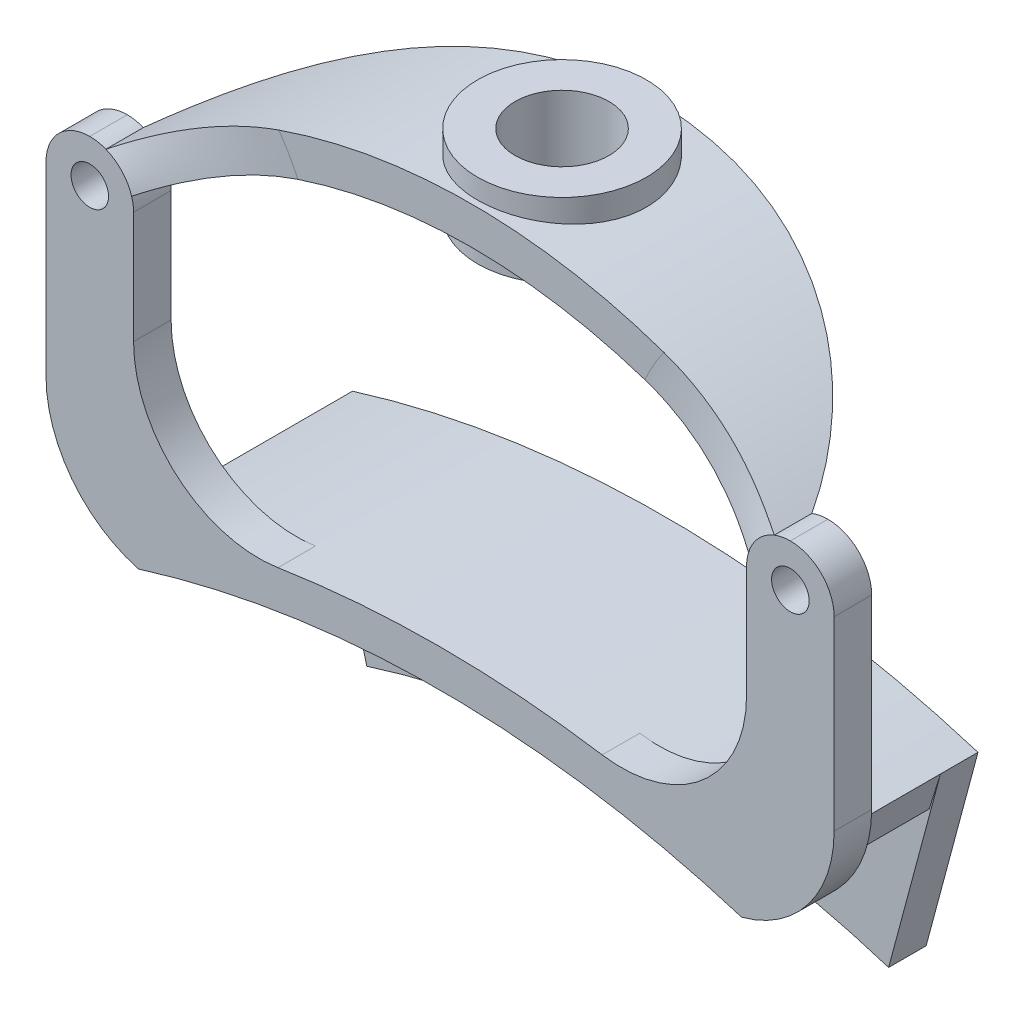
from build123d import *

# Parameters (mm, degrees)
SKETCH1_R                 = 2
BOSS_EXTRUDE1_DEPTH       = 3
BOSS_EXTRUDE2_DEPTH       = 12
SKETCH3_R                 = 1.5
BOSS_EXTRUDE3_DEPTH       = 3
FILLET1_R                 = 10
FILLET3_R                 = 3.5
BOSS_EXTRUDE6_DEPTH       = 14
BOSS_EXTRUDE7_DEPTH       = 0.5
BOSS_EXTRUDE8_START       = -14
BOSS_EXTRUDE8_DEPTH       = 14
FILLET7_R                 = 30
FILLET11_R                = 30
CUT_EXTRUDE3_REACH        = 52.603
CUT_EXTRUDE3_END_RADIUS   = 47
SKETCH12_R                = 3.75
BOSS_EXTRUDE9_REACH       = 64
BOSS_EXTRUDE9_END_RADIUS  = 47
SKETCH13_R                = 6.75
SKETCH13_R_2              = 3.75
BOSS_EXTRUDE10_REACH      = 59.242
BOSS_EXTRUDE10_END_RADIUS = 44
SKETCH14_R                = 6.75
SKETCH14_R_2              = 3.75


# Some blends are built 0.0001 mm under size
with BuildPart() as part:
    # Sketch1 → Boss-Extrude1 (new body)
    with BuildSketch(Plane.XY):
        with BuildLine():
            Line((20.854716842, 64.723108589), (25, 80.193515947))
            ThreePointArc((25, 80.193515947), (0, 84), (-25, 80.193515947))
            Line((-25, 80.193515947), (-20.854716842, 64.723108589))
            ThreePointArc((-20.854716842, 64.723108589), (0, 68), (20.854716842, 64.723108589))
        make_face()
        with Locations((15, 70.420167566)):
            Circle(SKETCH1_R, mode=Mode.SUBTRACT)
        with Locations(Location((-15, 70.420167566, 0), (0, 0, 180))):
            Circle(SKETCH1_R, mode=Mode.SUBTRACT)
    extrude(amount=BOSS_EXTRUDE1_DEPTH)

    # Sketch2 → Boss-Extrude2 (add)
    with BuildSketch(Plane.XY.offset(3)):
        with BuildLine():
            Line((-25, 80.193515947), (-24.107142857, 77.329461806))
            ThreePointArc((-24.107142857, 77.329461806), (0, 81), (24.107142857, 77.329461806))
            Line((24.107142857, 77.329461806), (25, 80.193515947))
            ThreePointArc((25, 80.193515947), (0, 84), (-25, 80.193515947))
        make_face()
    extrude(amount=BOSS_EXTRUDE2_DEPTH)

    # Sketch3 → Boss-Extrude3 (add)
    with BuildSketch(Plane.XY.offset(15)):
        with BuildLine():
            Line((-31.5, 77.329461806), (-31.5, 105.329461806))
            Line((-31.5, 105.329461806), (-24.5, 105.329461806))
            Line((-24.5, 105.329461806), (-24.5, 80.347681983))
            ThreePointArc((-24.5, 80.347681983), (0, 84), (24.5, 80.347681983))
            Line((24.5, 80.347681983), (24.5, 105.329461806))
            Line((24.5, 105.329461806), (31.5, 105.329461806))
            Line((31.5, 105.329461806), (31.5, 77.329461806))
            Line((31.5, 77.329461806), (24.107142857, 77.329461806))
            ThreePointArc((24.107142857, 77.329461806), (0, 81), (-24.107142857, 77.329461806))
            Line((-24.107142857, 77.329461806), (-31.5, 77.329461806))
        make_face()
        with Locations((-28, 101.920167566)):
            Circle(SKETCH3_R, mode=Mode.SUBTRACT)
        with Locations(Location((28, 101.920167566, 0), (0, 0, 180))):
            Circle(SKETCH3_R, mode=Mode.SUBTRACT)
    extrude(amount=BOSS_EXTRUDE3_DEPTH)

    # Fillet1
    # the kernel refuses this fillet: 10 mm, written as the material it adds along each edge
    with BuildSketch(Plane(origin=(24.5, 80.347681983, 15), x_dir=(-0.9747000358663407, 0.22351697940459464, 0), z_dir=(0, 0, 1))) as fillet1_piece_1:
        with BuildLine():
            CenterArc((12.54704984, -9.975125536), FILLET1_R, 94.042076765, 98.87360977)
            Line((2.800049481, -12.21029533), (0, 0))
            ThreePointArc((0, 0), (5.9210797, -0.208945494), (11.8421594, 0))
        make_face()
    extrude(amount=3)
    with BuildSketch(Plane(origin=(-24.5, 80.347681983, 15), x_dir=(0.9747000358663402, 0.22351697940459697, 0), z_dir=(0, 0, 1))) as fillet1_piece_2:
        with BuildLine():
            CenterArc((12.54704984, 9.975125536), FILLET1_R, 167.084313465, 98.87360977)
            Line((2.800049481, 12.21029533), (0, 0))
            ThreePointArc((0, 0), (5.9210797, 0.208945494), (11.8421594, 0))
        make_face()
    extrude(amount=3)
    # the kernel refuses this fillet: 10 mm, written as the material it takes off along each edge
    with BuildSketch(Plane(origin=(31.5, 77.329461806, 15), x_dir=(0, 1, 0), z_dir=(0, 0, 1))) as fillet1_2_piece_1:
        with BuildLine():
            CenterArc((9.654160042, 10), FILLET1_R, 195.112449543, 74.887550457)
            Line((0, 7.392857143), (0, 0))
            Line((0, 0), (9.654160042, 0))
        make_face()
    extrude(amount=27.135400106, mode=Mode.SUBTRACT)
    with BuildSketch(Plane(origin=(-31.5, 77.329461806, 15), x_dir=(0, 1, 0), z_dir=(0, 0, 1))) as fillet1_2_piece_2:
        with BuildLine():
            CenterArc((9.654160042, -10), FILLET1_R, 90, 74.887550457)
            Line((0, -7.392857143), (0, 0))
            Line((0, 0), (9.654160042, 0))
        make_face()
    extrude(amount=27.135400106, mode=Mode.SUBTRACT)

    # Fillet3
    fillet3_edges = [part.edges().sort_by_distance(p)[0] for p in [
        (31.5, 105.329461806, 16.5),
        (24.5, 105.329461806, 16.5),
        (-24.5, 105.329461806, 16.5),
        (-31.5, 105.329461806, 16.5),
    ]]
    fillet(fillet3_edges, radius=FILLET3_R - 0.0001)  # a hair under: the kernel refuses the full size



with BuildPart() as body_2:
    # Sketch9 → Boss-Extrude6 (new body)
    with BuildSketch(Plane(origin=(0, 0, 15), x_dir=(-1, 0, 0), z_dir=(0, 0, -1))):
        with BuildLine():
            ThreePointArc((24.654911386, 102.8592104), (0, 110.415619131), (-24.654911386, 102.8592104))
            ThreePointArc((-24.654911386, 102.8592104), (-25.431275444, 104.2067826), (-26.71481938, 105.084966494))
            ThreePointArc((-26.71481938, 105.084966494), (0, 113.415619131), (26.71481938, 105.084966494))
            ThreePointArc((26.71481938, 105.084966494), (25.431275444, 104.2067826), (24.654911386, 102.8592104))
        make_face()
    extrude(amount=BOSS_EXTRUDE6_DEPTH)


with BuildPart() as part_1:
    add(part.part)

    add(body_2.part)  # Boss-Extrude7 merges body 2
    # Sketch10 → Boss-Extrude7 (add)
    with BuildSketch(Plane.XY.offset(15)):
        with BuildLine():
            ThreePointArc((-24.654911386, 102.8592104), (-25.431275444, 104.2067826), (-26.71481938, 105.084966494))
            ThreePointArc((-26.71481938, 105.084966494), (0, 113.415619131), (26.71481938, 105.084966494))
            ThreePointArc((26.71481938, 105.084966494), (25.431275444, 104.2067826), (24.654911386, 102.8592104))
            ThreePointArc((24.654911386, 102.8592104), (0, 110.415619131), (-24.654911386, 102.8592104))
        make_face()
    extrude(amount=BOSS_EXTRUDE7_DEPTH)

    # Sketch11 → Boss-Extrude8 (add)
    with BuildSketch(Plane(origin=(0, 0, 1), x_dir=(-1, 0, 0), z_dir=(0, 0, -1)).offset(BOSS_EXTRUDE8_START)):
        with BuildLine():
            Line((-26.71481938, 105.084966494), (-24.654911386, 102.8592104))
            ThreePointArc((-24.654911386, 102.8592104), (-25.431275444, 104.2067826), (-26.71481938, 105.084966494))
        make_face()
        with BuildLine():
            Line((26.71481938, 105.084966494), (24.654911386, 102.8592104))
            ThreePointArc((24.654911386, 102.8592104), (25.431275444, 104.2067826), (26.71481938, 105.084966494))
        make_face()
    extrude(amount=BOSS_EXTRUDE8_DEPTH)

    # Fillet7
    # the kernel refuses this fillet: 30 mm, written as the material it takes off along each edge
    with BuildSketch(Plane(origin=(69.80741828, 151.647053217, 1), x_dir=(-0.7339213016528682, 0.6792345125066597, 0), z_dir=(-0.6792345125066598, -0.7339213016528682, 0))) as fillet7_piece_1_section:
        with BuildLine():
            CenterArc((25.377155081, -30), FILLET7_R, 90, 57.769047365)
            Line((0, -14), (0, 0))
            Line((0, 0), (25.377155081, 0))
        make_face()
    fillet7_piece_1 = extrude(amount=129.918465817, mode=Mode.PRIVATE)
    fillet7_piece_1 = fillet7_piece_1 - Plane(origin=(0, 0, 1), x_dir=(0.2976190476190481, 0.9546847136590859, 0), z_dir=(0, 0, -1)) * Cylinder(84, 362, mode=Mode.PRIVATE)
    add(fillet7_piece_1, mode=Mode.SUBTRACT)
    with BuildSketch(Plane(origin=(-69.80741828, 151.647053217, 1), x_dir=(0, 0, 1), z_dir=(0.6792345125066636, -0.7339213016528646, 0))) as fillet7_piece_2_section:
        with BuildLine():
            CenterArc((30, -25.377155081), FILLET7_R, 122.230952636, 57.769047365)
            Line((0, -25.377155081), (0, 0))
            Line((0, 0), (14, 0))
        make_face()
    fillet7_piece_2 = extrude(amount=129.918465817, mode=Mode.PRIVATE)
    fillet7_piece_2 = fillet7_piece_2 - Plane(origin=(0, 0, 1), x_dir=(0.2976190476190481, 0.9546847136590859, 0), z_dir=(0, 0, -1)) * Cylinder(84, 362, mode=Mode.PRIVATE)
    add(fillet7_piece_2, mode=Mode.SUBTRACT)

    # Fillet11
    # the kernel refuses this fillet: 30 mm, written as the material it adds along each edge
    with BuildSketch(Plane(origin=(27.9999, 101.829561806, 15.5), x_dir=(0.5609336863803128, 0.8278607367690491, 0), z_dir=(0.8278607367690491, -0.5609336863803128, 0))) as fillet11_piece_1_section:
        with BuildLine():
            CenterArc((15.489478808, 30), FILLET11_R, 246.443535691, 23.556464309)
            Line((3.4999, 2.5), (3.4999, 0))
            Line((3.4999, 0), (15.489478808, 0))
        make_face()
    fillet11_piece_1 = revolve(axis=Axis((27.9999, 101.829561806, 15.5), (0, 0, 1)), revolution_arc=359.64, mode=Mode.PRIVATE)
    fillet11_piece_1 = fillet11_piece_1 & Plane(origin=(0, 66.415619131, 15.5), x_dir=(0.5684004123362708, 0.8227520715598091, 0), z_dir=(0, 0, 1)) * Cylinder(47, 62, mode=Mode.PRIVATE)
    fillet11_piece_1 = fillet11_piece_1 - Plane(origin=(0, 66.415619131, 15.5), x_dir=(-0.5603388951384309, 0.8282634379199909, 0), z_dir=(0, 0, 1)) * Cylinder(44, 62, mode=Mode.PRIVATE)
    fillet11_piece_1 = split(fillet11_piece_1, bisect_by=Plane(origin=(31.5, 101.829561806, 15.5), z_dir=(-1, 0, 0)), keep=Keep.TOP, mode=Mode.PRIVATE)
    add(fillet11_piece_1)
    with BuildSketch(Plane(origin=(-27.9999, 101.829561806, 15.5), x_dir=(-0.5661241822221539, 0.8243199684001945, 0), z_dir=(0.8243199684001945, 0.5661241822221539, 0))) as fillet11_piece_2_section:
        with BuildLine():
            CenterArc((15.489478808, 30), FILLET11_R, 246.443535691, 23.556464309)
            Line((3.4999, 2.5), (3.4999, 0))
            Line((3.4999, 0), (15.489478808, 0))
        make_face()
    fillet11_piece_2 = revolve(axis=Axis((-27.9999, 101.829561806, 15.5), (0, 0, 1)), revolution_arc=359.64, mode=Mode.PRIVATE)
    fillet11_piece_2 = fillet11_piece_2 & Plane(origin=(0, 66.415619131, 15.5), x_dir=(0.5684004123362708, 0.8227520715598091, 0), z_dir=(0, 0, 1)) * Cylinder(47, 62, mode=Mode.PRIVATE)
    fillet11_piece_2 = fillet11_piece_2 - Plane(origin=(0, 66.415619131, 15.5), x_dir=(-0.5603388951384309, 0.8282634379199909, 0), z_dir=(0, 0, 1)) * Cylinder(44, 62, mode=Mode.PRIVATE)
    fillet11_piece_2 = split(fillet11_piece_2, bisect_by=Plane(origin=(-31.5, 101.829561806, 15.5), z_dir=(1, 0, 0)), keep=Keep.TOP, mode=Mode.PRIVATE)
    add(fillet11_piece_2)

    # Cut-Extrude3: up to this cylinder (the profile starts inside it)
    cut_extrude3_end = Plane(origin=(0, 66.415619131, 8.250105), z_dir=(0, 0, -1)) * Cylinder(CUT_EXTRUDE3_END_RADIUS, 200.206, mode=Mode.PRIVATE)
    # Sketch12 → Cut-Extrude3 (cut, up to the surface)
    with BuildSketch(Plane(origin=(0, 100, 0), x_dir=(1, 0, 0), z_dir=(0, 1, 0)), mode=Mode.PRIVATE) as cut_extrude3_sk1:
        with Locations(Location((0, -8.250104745, 0), (0, 0, 90))):
            Circle(SKETCH12_R)
    cut_extrude3_tool1 = extrude(cut_extrude3_sk1.sketch, amount=CUT_EXTRUDE3_REACH, mode=Mode.PRIVATE) & cut_extrude3_end
    add(cut_extrude3_tool1.solids().sort_by_distance((0, 100, 8.250105))[0], mode=Mode.SUBTRACT)

    # Boss-Extrude9: up to this cylinder (the profile starts outside it)
    boss_extrude9_end = Plane(origin=(0, 66.415619131, 1.691024), z_dir=(0, 0, -1)) * Cylinder(BOSS_EXTRUDE9_END_RADIUS, 223, mode=Mode.PRIVATE)
    # Sketch13 → Boss-Extrude9 (add, up to the surface)
    with BuildSketch(Plane(origin=(0, 115, 0), x_dir=(1, 0, 0), z_dir=(0, 1, 0)), mode=Mode.PRIVATE) as boss_extrude9_sk1:
        with Locations(Location((0, -8.250104745, 0), (0, 0, 270))):
            Circle(SKETCH13_R)
        with Locations(Location((0, -8.250104745, 0), (0, 0, 90))):
            Circle(SKETCH13_R_2, mode=Mode.SUBTRACT)
    boss_extrude9_tool1 = extrude(boss_extrude9_sk1.sketch, amount=-BOSS_EXTRUDE9_REACH, mode=Mode.PRIVATE) - boss_extrude9_end
    add(boss_extrude9_tool1.solids().sort_by_distance((0, 115, 1.691024))[0])

    # Boss-Extrude10: up to this cylinder (the profile starts inside it)
    boss_extrude10_end = Plane(origin=(0, 66.415619131, 1.691024), z_dir=(0, 0, -1)) * Cylinder(BOSS_EXTRUDE10_END_RADIUS, 207.484, mode=Mode.PRIVATE)
    # Sketch14 → Boss-Extrude10 (add, up to the surface)
    with BuildSketch(Plane(origin=(0, 109, 0), x_dir=(1, 0, 0), z_dir=(0, 1, 0)), mode=Mode.PRIVATE) as boss_extrude10_sk1:
        with Locations(Location((0, -8.250104745, 0), (0, 0, 270))):
            Circle(SKETCH14_R)
        with Locations(Location((0, -8.250104745, 0), (0, 0, 270))):
            Circle(SKETCH14_R_2, mode=Mode.SUBTRACT)
    boss_extrude10_tool1 = extrude(boss_extrude10_sk1.sketch, amount=BOSS_EXTRUDE10_REACH, mode=Mode.PRIVATE) & boss_extrude10_end
    add(boss_extrude10_tool1.solids().sort_by_distance((0, 109, 1.691024))[0])


solid = part_1.part
